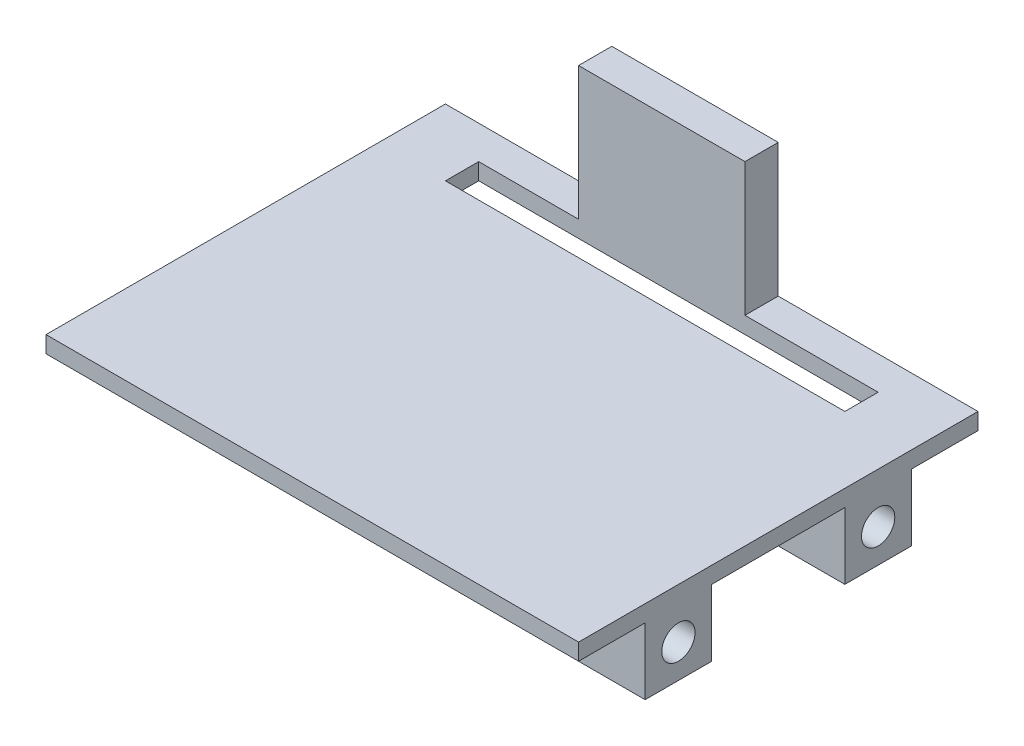
from build123d import *

# Parameters (mm, degrees)
SKETCH2_W           = 203.2
SKETCH2_H           = 152.4
BOSS_EXTRUDE1_DEPTH = 6.35
SKETCH3_W           = 152.4
SKETCH3_H           = 12.7
CUT_EXTRUDE1_DEPTH  = 6.35
SKETCH4_W           = 50.8
SKETCH4_H           = 25.4
BOSS_EXTRUDE2_DEPTH = 25.4
SKETCH7_R           = 6.35
CUT_EXTRUDE2_DEPTH  = 50.8
CUT_EXTRUDE3_START  = -50.8
SKETCH8_R           = 6.35
CUT_EXTRUDE3_DEPTH  = 50.8
SKETCH12_W          = 63.5
SKETCH12_H          = 12.7
BOSS_EXTRUDE3_DEPTH = 50.8


with BuildPart() as part:
    # Sketch2 → Boss-Extrude1 (new body)
    with BuildSketch(Plane(origin=(0, 0, 0), x_dir=(1, 0, 0), z_dir=(0, 1, 0))):
        Rectangle(SKETCH2_W, SKETCH2_H)
    extrude(amount=BOSS_EXTRUDE1_DEPTH)

    # Sketch3 → Cut-Extrude1 (cut)
    with BuildSketch(Plane(origin=(0, 6.35, 0), x_dir=(1, 0, 0), z_dir=(0, 1, 0))):
        with Locations((0, 57.15)):
            Rectangle(SKETCH3_W, SKETCH3_H)
    extrude(amount=-CUT_EXTRUDE1_DEPTH, mode=Mode.SUBTRACT)

    # Sketch4 → Boss-Extrude2 (add)
    with BuildSketch(Plane.XZ):
        with Locations((-76.2, 38.1)):
            Rectangle(SKETCH4_W, SKETCH4_H)
        with Locations((76.2, 38.1)):
            Rectangle(SKETCH4_W, SKETCH4_H)
        with Locations((76.2, -38.1)):
            Rectangle(SKETCH4_W, SKETCH4_H)
        with Locations((-76.2, -38.1)):
            Rectangle(SKETCH4_W, SKETCH4_H)
    extrude(amount=BOSS_EXTRUDE2_DEPTH)

    # Sketch7 → Cut-Extrude2 (cut)
    with BuildSketch(Plane.ZY.offset(101.6)):
        with Locations((-38.1, -12.7)):
            Circle(SKETCH7_R)
        with Locations((38.1, -12.7)):
            Circle(SKETCH7_R)
    extrude(amount=-CUT_EXTRUDE2_DEPTH, mode=Mode.SUBTRACT)

    # Sketch8 → Cut-Extrude3 (cut)
    with BuildSketch(Plane(origin=(101.6, 0, 0), x_dir=(0, 0, -1), z_dir=(1, 0, 0)).offset(CUT_EXTRUDE3_START)):
        with Locations((-38.1, -12.7)):
            Circle(SKETCH8_R)
        with Locations((38.1, -12.7)):
            Circle(SKETCH8_R)
    extrude(amount=CUT_EXTRUDE3_DEPTH, mode=Mode.SUBTRACT)

    # Sketch12 → Boss-Extrude3 (add)
    with BuildSketch(Plane(origin=(0, 6.35, 0), x_dir=(1, 0, 0), z_dir=(0, 1, 0))):
        with Locations((-6.370358214, 69.85)):
            Rectangle(SKETCH12_W, SKETCH12_H)
    extrude(amount=BOSS_EXTRUDE3_DEPTH)


solid = part.part
